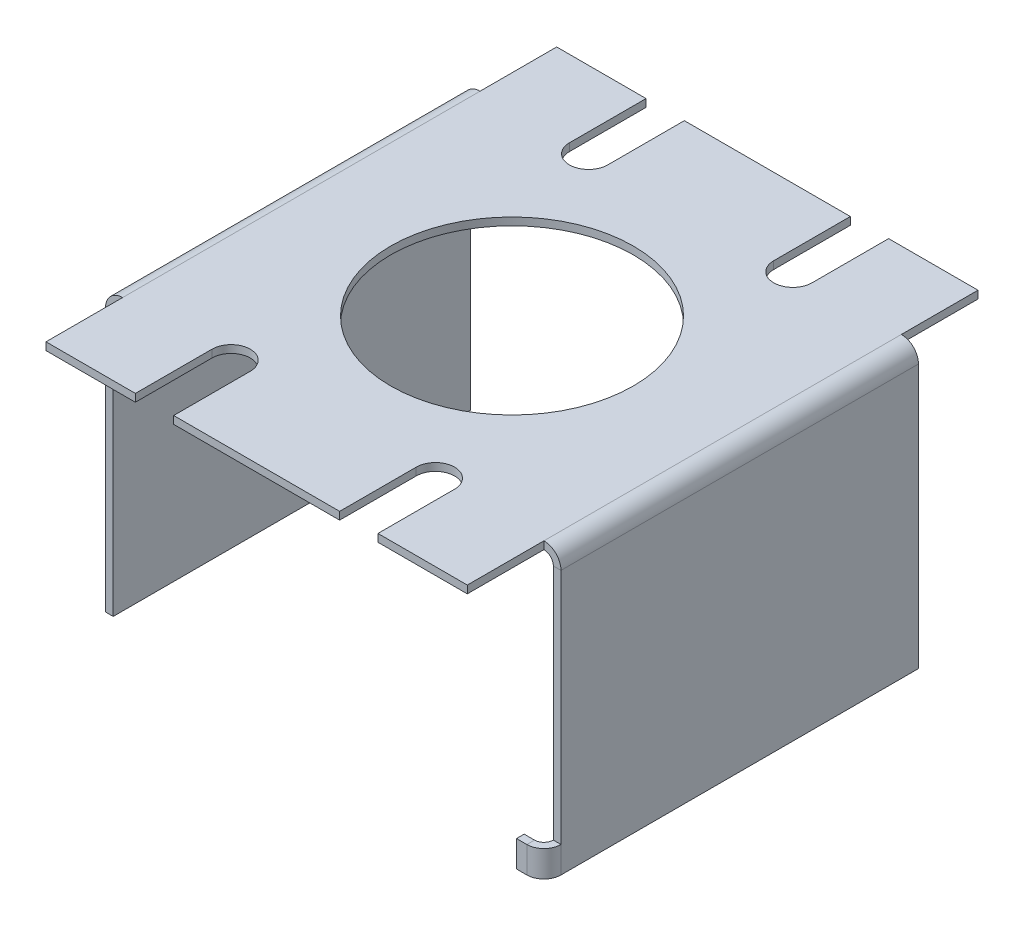
from build123d import *

# Parameters (mm, degrees)
SKETCH1_W           = 33
SKETCH1_H           = 40
BASE_FLANGE1_DEPTH  = 0.6
CUT_EXTRUDE1_DEPTH  = 10
EDGE_FLANGE1_DEPTH  = 28
SKETCH21_R          = 9.5
CUT_EXTRUDE11_DEPTH = 10
EDGE_FLANGE2_DEPTH  = 2.068329304


# Sheet-metal steps are written as plain solids
with BuildPart() as part:
    # Sketch1 → Base-Flange1 (new body)
    with BuildSketch(Plane(origin=(0, 0, 0), x_dir=(1, 0, 0), z_dir=(0, 1, 0))):
        Rectangle(SKETCH1_W, SKETCH1_H)
    extrude(amount=-BASE_FLANGE1_DEPTH)

    # Sketch6 → Cut-Extrude1 (cut)
    with BuildSketch(Plane(origin=(0, 0, 0), x_dir=(1, 0, 0), z_dir=(0, 1, 0))):
        with BuildLine():
            Line((-9.5, 20), (-9.5, 14))
            ThreePointArc((-9.5, 14), (-8, 12.5), (-6.5, 14))
            Line((-6.5, 14), (-6.5, 20))
            Line((-6.5, 20), (-9.5, 20))
        make_face()
        with BuildLine():
            Line((6.5, 20), (6.5, 14))
            ThreePointArc((6.5, 14), (8, 12.5), (9.5, 14))
            Line((9.5, 14), (9.5, 20))
            Line((9.5, 20), (6.5, 20))
        make_face()
        with BuildLine():
            Line((9.5, -20), (9.5, -14))
            ThreePointArc((9.5, -14), (8, -12.5), (6.5, -14))
            Line((6.5, -14), (6.5, -20))
            Line((6.5, -20), (9.5, -20))
        make_face()
        with BuildLine():
            Line((-9.5, -20), (-6.5, -20))
            Line((-6.5, -20), (-6.5, -14))
            ThreePointArc((-6.5, -14), (-8, -12.5), (-9.5, -14))
            Line((-9.5, -14), (-9.5, -20))
        make_face()
    extrude(amount=-CUT_EXTRUDE1_DEPTH, mode=Mode.SUBTRACT)

    # Edge-Flange1 section (across the edge) → Edge-Flange1 (add)
    with BuildSketch(Plane(origin=(17.2366, -0.6, -14), x_dir=(-1, 0, 0), z_dir=(0, 0, 1))):
        with BuildLine():
            Line((-0.6, 0.7366), (-0.6, 21.4))
            Line((-0.6, 21.4), (0, 21.4))
            Line((0, 21.4), (0, 0.7366))
            ThreePointArc((0, 0.7366), (0.215745145, 0.215745145), (0.7366, 0))
            Line((0.7366, 0), (0.7366, -0.6))
            ThreePointArc((0.7366, -0.6), (-0.208518924, -0.208518924), (-0.6, 0.7366))
        make_face()
    edge_flange1 = extrude(amount=EDGE_FLANGE1_DEPTH)

    # Mirror1: Edge-Flange1 across plane
    add(edge_flange1.mirror(Plane(origin=(0, 0, 0), x_dir=(0, 0, 1), z_dir=(1, 0, 0))))

    # Sketch21 → Cut-Extrude11 (cut)
    with BuildSketch(Plane(origin=(0, 0, 0), x_dir=(1, 0, 0), z_dir=(0, 1, 0))):
        with Locations(Location((0, 0, 0), (0, 0, 270))):
            Circle(SKETCH21_R)
    extrude(amount=-CUT_EXTRUDE11_DEPTH, mode=Mode.SUBTRACT)

    # Edge-Flange2 section (across the edge) → Edge-Flange2 (add)
    with BuildSketch(Plane(origin=(17.2366, -22, 14.7366), x_dir=(0, 0, -1), z_dir=(0, 1, 0))):
        with BuildLine():
            Line((-0.6, 0.7366), (-0.6, 1.546122954))
            Line((-0.6, 1.546122954), (0, 1.546122954))
            Line((0, 1.546122954), (0, 0.7366))
            ThreePointArc((0, 0.7366), (0.215745145, 0.215745145), (0.7366, 0))
            Line((0.7366, 0), (0.7366, -0.6))
            ThreePointArc((0.7366, -0.6), (-0.208518924, -0.208518924), (-0.6, 0.7366))
        make_face()
    extrude(amount=EDGE_FLANGE2_DEPTH)


solid = part.part
